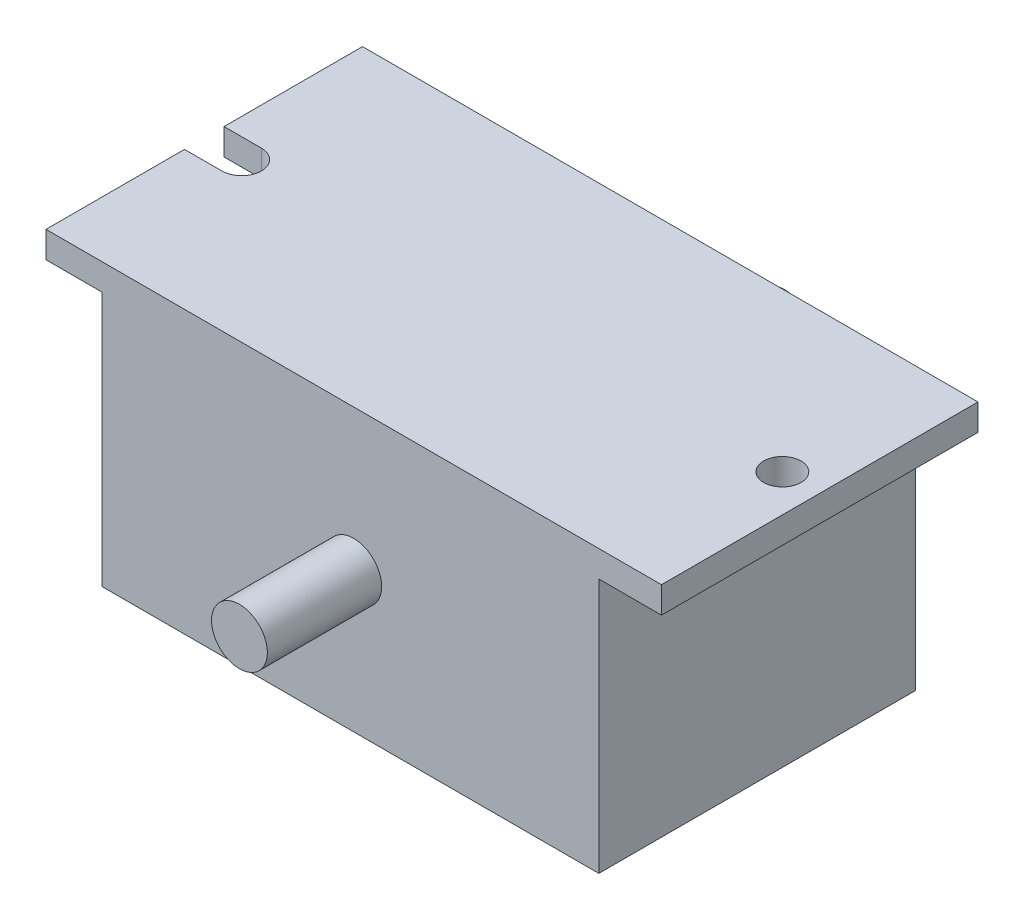
from build123d import *

# Parameters (mm, degrees)
BOSS_EXTRUDE1_DEPTH = 72
SKETCH2_R           = 4.25
CUT_EXTRUDE1_DEPTH  = 120.079805173
SKETCH3_R           = 6.35
BOSS_EXTRUDE2_DEPTH = 26
BOSS_EXTRUDE3_START = 26
SKETCH5_R           = 6.35
BOSS_EXTRUDE3_DEPTH = 26


with BuildPart() as part:
    # Sketch1 → Boss-Extrude1 (new body)
    with BuildSketch(Plane.XY):
        Polygon((-56.490044248, 32.210989011), (58.009955752, 32.210989011), (70, 32.210989011), (70, 26.210989011), (55.75, 26.210989011), (55.75, -31.789010989), (-57.25, -31.789010989), (-57.25, 26.210989011), (-70, 26.210989011), (-70, 32.210989011), align=None)
    extrude(amount=BOSS_EXTRUDE1_DEPTH)

    # Sketch2 → Cut-Extrude1 (cut, through all)
    with BuildSketch(Plane(origin=(0, 32.210989011, 0), x_dir=(1, 0, 0), z_dir=(0, 1, 0))):
        with Locations((61.5, -36)):
            Circle(SKETCH2_R)
        with BuildLine():
            Line((-61.5, -31.5), (-70, -31.5))
            Line((-70, -31.5), (-70, -40.5))
            Line((-70, -40.5), (-61.5, -40.5))
            ThreePointArc((-61.5, -40.5), (-57, -36), (-61.5, -31.5))
        make_face()
    extrude(amount=-CUT_EXTRUDE1_DEPTH, mode=Mode.SUBTRACT)

    # Sketch3 → Boss-Extrude2 (add)
    with BuildSketch(Plane.XY.offset(72)):
        Circle(SKETCH3_R)
    extrude(amount=BOSS_EXTRUDE2_DEPTH)

    # Sketch5 → Boss-Extrude3 (add)
    with BuildSketch(Plane(origin=(0, 0, 0), x_dir=(-1, 0, 0), z_dir=(0, 0, -1)).offset(BOSS_EXTRUDE3_START)):
        Circle(SKETCH5_R)
    extrude(amount=-BOSS_EXTRUDE3_DEPTH)


solid = part.part
